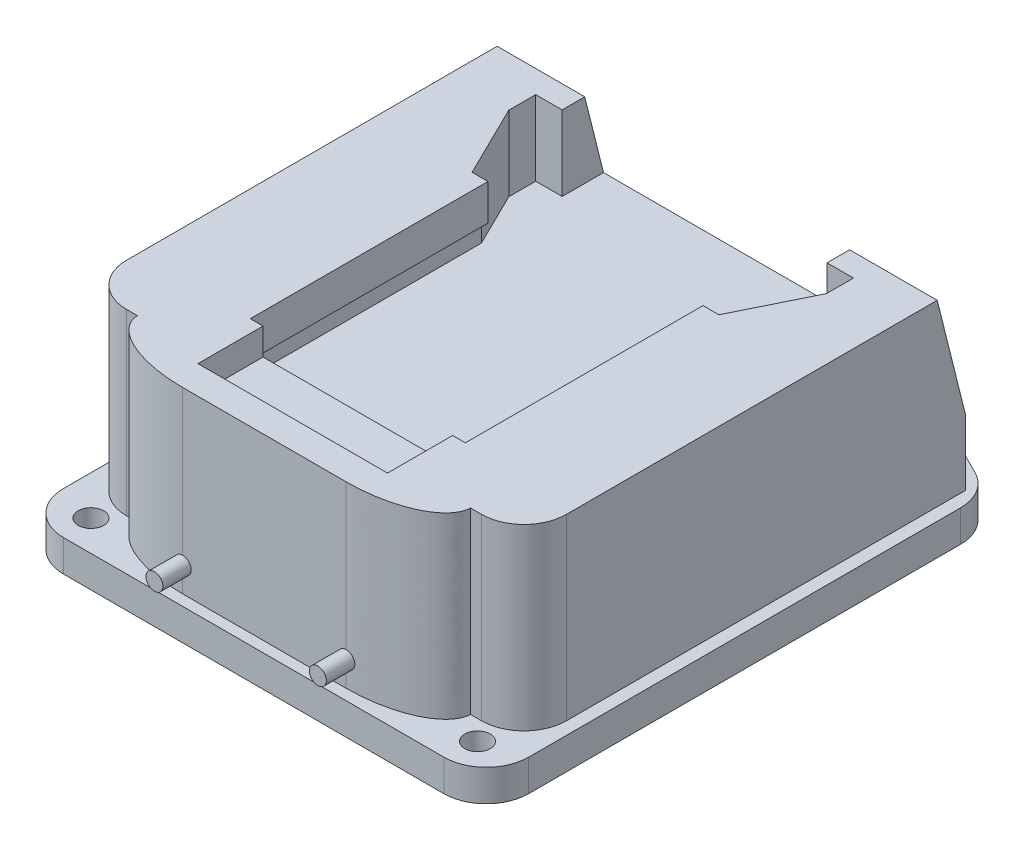
from build123d import *

# Parameters (mm, degrees)
SKETCH1_W            = 77.75
SKETCH1_H            = 85
BOSS_EXTRUDE1_DEPTH  = 15.795
SKETCH2_W            = 82.2071
SKETCH2_H            = 98.425
BOSS_EXTRUDE2_DEPTH  = 5.588
M4_CLEARANCE_HOLE1_D = 4.5
CHAMFER1_SIZE        = 20
CHAMFER1_SIZE2       = 10
CHAMFER2_SIZE        = 10
CHAMFER2_SIZE2       = 20
CUT_EXTRUDE1_DEPTH   = 13.25
SKETCH7_W            = 4.4
SKETCH7_H            = 6.87
CUT_EXTRUDE2_DEPTH   = 68.5
SKETCH9_W            = 33.5
SKETCH9_H            = 11.5
CUT_EXTRUDE3_DEPTH   = 4.75
SKETCH10_W           = 9.4429
SKETCH10_H           = 6.99
CUT_EXTRUDE4_DEPTH   = 31.59
FILLET1_R            = 7.5
FILLET2_START        = -15.795
FILLET2_DEPTH        = 32.795
FILLET3_START        = -15.795
FILLET3_DEPTH        = 32.795
CHAMFER3_SIZE        = 5
CHAMFER3_SIZE2       = 20
SKETCH11_R           = 1.5
BOSS_EXTRUDE3_DEPTH  = 5


with BuildPart() as part:
    # Sketch1 → Boss-Extrude1 (new, symmetric)
    with BuildSketch(Plane(origin=(0, 0, 0), x_dir=(1, 0, 0), z_dir=(0, 1, 0))):
        Rectangle(SKETCH1_W, SKETCH1_H)
    extrude(amount=BOSS_EXTRUDE1_DEPTH, both=True)

    # Sketch2 → Boss-Extrude2 (add)
    with BuildSketch(Plane.XZ.offset(15.795)):
        with Locations((0, -4.8075)):
            Rectangle(SKETCH2_W, SKETCH2_H)
    extrude(amount=BOSS_EXTRUDE2_DEPTH)

    # M4 Clearance Hole1 (through all)
    with Locations(Plane(origin=(0, -21.383, 0), x_dir=(-1, 0, 0), z_dir=(0, -1, 0))):
        with Locations((-19.79355, 48.62), (19.79355, 48.62), (34.15355, -39.005), (-34.15355, -39.005)):
            Hole(M4_CLEARANCE_HOLE1_D / 2)

    # Chamfer1
    chamfer1_edges = [part.edges().sort_by_distance(p)[0] for p in [
        (41.10355, -18.589, -54.02),
    ]]
    chamfer1_side = [part.faces().sort_by_distance(p)[0] for p in [
        (0, -18.589, -54.02),
    ]]
    chamfer(chamfer1_edges, length=CHAMFER1_SIZE, length2=CHAMFER1_SIZE2, reference=chamfer1_side[0])

    # Chamfer2
    chamfer2_edges = [part.edges().sort_by_distance(p)[0] for p in [
        (-41.10355, -18.589, -54.02),
    ]]
    chamfer2_side = [part.faces().sort_by_distance(p)[0] for p in [
        (-41.10355, -18.589, -4.8075),
    ]]
    chamfer(chamfer2_edges, length=CHAMFER2_SIZE, length2=CHAMFER2_SIZE2, reference=chamfer2_side[0])

    # Sketch6 → Cut-Extrude1 (cut)
    with BuildSketch(Plane(origin=(0, 15.795, 0), x_dir=(1, 0, 0), z_dir=(0, 1, 0))):
        Polygon((-23.4, 42.5), (-23.4, 33.5), (-28.07, 33.5), (-28.07, 28.75), (-21.81, 16), (-19, 16), (-19, -26), (19, -26), (19, 16), (21.81, 16), (28.07, 28.75), (28.07, 33.5), (23.4, 33.5), (23.4, 42.5), align=None)
    extrude(amount=-CUT_EXTRUDE1_DEPTH, mode=Mode.SUBTRACT)

    # Sketch7 → Cut-Extrude2 (cut)
    with BuildSketch(Plane(origin=(0, 0, -42.5), x_dir=(-1, 0, 0), z_dir=(0, 0, -1))):
        with Locations((-21.2, 5.98)):
            Rectangle(SKETCH7_W, SKETCH7_H)
    cut_extrude2 = extrude(amount=-CUT_EXTRUDE2_DEPTH, mode=Mode.SUBTRACT)

    # Mirror7: Cut-Extrude2 across plane
    add(cut_extrude2.mirror(Plane(origin=(0, 0, 0), x_dir=(0, 0, 1), z_dir=(1, 0, 0))), mode=Mode.SUBTRACT)

    # Sketch9 → Cut-Extrude3 (cut)
    with BuildSketch(Plane(origin=(0, 15.795, 0), x_dir=(1, 0, 0), z_dir=(0, 1, 0))):
        with Locations((0, -31.75)):
            Rectangle(SKETCH9_W, SKETCH9_H)
    extrude(amount=-CUT_EXTRUDE3_DEPTH, mode=Mode.SUBTRACT)

    # Sketch10 → Cut-Extrude4 (cut)
    with BuildSketch(Plane(origin=(0, 15.795, 0), x_dir=(1, 0, 0), z_dir=(0, 1, 0))):
        with Locations((34.15355, -39.005)):
            Rectangle(SKETCH10_W, SKETCH10_H)
    cut_extrude4 = extrude(amount=-CUT_EXTRUDE4_DEPTH, mode=Mode.SUBTRACT)

    # Mirror8: Cut-Extrude4 across plane
    add(cut_extrude4.mirror(Plane(origin=(0, 0, 0), x_dir=(0, 0, 1), z_dir=(1, 0, 0))), mode=Mode.SUBTRACT)

    # Fillet1
    fillet1_edges = [part.edges().sort_by_distance(p)[0] for p in [
        (41.10355, -18.589, 44.405),
        (-41.10355, -18.589, 44.405),
        (38.875, 0, 35.51),
        (-38.875, 0, 35.51),
        (41.10355, -18.589, -44.02),
        (21.10355, -18.589, -54.02),
        (-21.10355, -18.589, -54.02),
        (-41.10355, -18.589, -44.02),
    ]]
    fillet(fillet1_edges, radius=FILLET1_R)

    # Fillet2: read off the stored shape, not the designer's step
    # Fillet2 outline → Fillet2 (cut)
    with BuildSketch(Plane(origin=(0, 0, 0), x_dir=(1, 0, 0), z_dir=(0, 1, 0)).offset(FILLET2_START)):
        with BuildLine():
            Line((-29.4321, -42.5), (-14.440772507, -42.5))
            add(Edge.make_bspline(
                [(-14.440772507, -42.5), (-29.194302513, -42.5), (-29.4321, -35.51)],
                knots=[0, 0, 0, 1, 1, 1], degree=2, weights=[1, 0.71902712, 1]))
            Line((-29.4321, -35.51), (-29.4321, -42.5))
        make_face()
    extrude(amount=FILLET2_DEPTH, mode=Mode.SUBTRACT)

    # Fillet3: read off the stored shape, not the designer's step
    # Fillet3 outline → Fillet3 (cut)
    with BuildSketch(Plane(origin=(0, 0, 0), x_dir=(1, 0, 0), z_dir=(0, 1, 0)).offset(FILLET3_START)):
        with BuildLine():
            add(Edge.make_bspline(
                [(14.440772507, -42.5), (29.194302513, -42.5), (29.4321, -35.51)],
                knots=[0, 0, 0, 1, 1, 1], degree=2, weights=[1, 0.71902712, 1]))
            Line((14.440772507, -42.5), (29.4321, -42.5))
            Line((29.4321, -42.5), (29.4321, -35.51))
        make_face()
    extrude(amount=FILLET3_DEPTH, mode=Mode.SUBTRACT)

    # Chamfer3
    chamfer3_edges = [part.edges().sort_by_distance(p)[0] for p in [
        (-31.1375, 15.795, -42.5),
    ]]
    chamfer3_side = [part.faces().sort_by_distance(p)[0] for p in [
        (30.40355, 15.795, 34.358042424),
    ]]
    chamfer(chamfer3_edges, length=CHAMFER3_SIZE, length2=CHAMFER3_SIZE2, reference=chamfer3_side[0])

    # Sketch11 → Boss-Extrude3 (add, symmetric)
    with BuildSketch(Plane.XY.offset(42.5)):
        with Locations(Location((-14.440772507, -11.383, 0), (0, 0, 270))):
            Circle(SKETCH11_R)
        with Locations(Location((14.440772507, -11.383, 0), (0, 0, 90))):
            Circle(SKETCH11_R)
    extrude(amount=BOSS_EXTRUDE3_DEPTH, both=True)


solid = part.part
